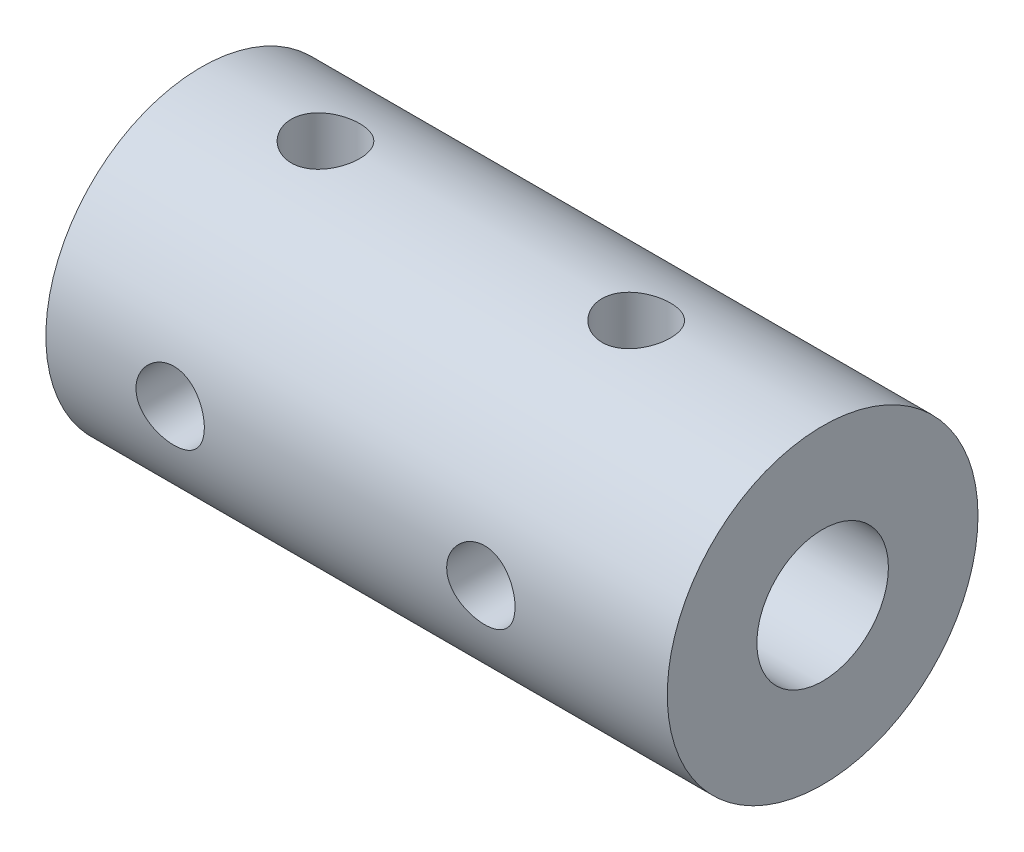
from build123d import *

# Parameters (mm, degrees)
CROQUIS1_R              = 7.5
CROQUIS1_R_2            = 3.877864762
SALIENTE_EXTRUIR1_DEPTH = 15
CROQUIS3_R              = 7.5
CROQUIS3_R_2            = 3.175
SALIENTE_EXTRUIR2_DEPTH = 15


with BuildPart() as part:
    # Croquis1 → Saliente-Extruir1 (new body)
    with BuildSketch(Plane(origin=(0, 0, 0), x_dir=(0, 0, -1), z_dir=(1, 0, 0))):
        Circle(CROQUIS1_R)
        Circle(CROQUIS1_R_2, mode=Mode.SUBTRACT)
    extrude(amount=SALIENTE_EXTRUIR1_DEPTH)

    # Croquis3 → Saliente-Extruir2 (add)
    with BuildSketch(Plane(origin=(15, 0, 0), x_dir=(0, 0, -1), z_dir=(1, 0, 0))):
        Circle(CROQUIS3_R)
        Circle(CROQUIS3_R_2, mode=Mode.SUBTRACT)
    extrude(amount=SALIENTE_EXTRUIR2_DEPTH)

    # Croquis5 → Perforador para roscar para macho de roscar para M4x0.72 (revolve, cut)
    with BuildSketch(Plane(origin=(6, 7.5, 0), x_dir=(0, 0, 1), z_dir=(1, 0, 0))):
        Polygon((0, 0), (0, 8.491420021), (1.65, 7.5), (1.65, 0), align=None)
    revolve(axis=Axis((6, 13.85, 0), (0, -1, 0)), mode=Mode.SUBTRACT)

    # Croquis5 at point 2 (carried to point 2, square into its face) → Perforador para roscar para macho de 2 (revolve, cut)
    with BuildSketch(Plane(origin=(6, 0, 7.5), x_dir=(0, -1, 0), z_dir=(1, 0, 0))):
        Polygon((0, 0), (0, 8.491420021), (1.65, 7.5), (1.65, 0), align=None)
    revolve(axis=Axis((6, 0, 13.85), (0, 0, -1)), mode=Mode.SUBTRACT)

    # Croquis5 at point 3 (carried to point 3, square into its face) → Perforador para roscar para macho de 3 (revolve, cut)
    with BuildSketch(Plane(origin=(-116.474048572, 0, -29.182020138), x_dir=(0, 0, 1), z_dir=(1, 0, 0))):
        Polygon((0, 0), (0, 8.491420021), (1.65, 7.5), (1.65, 0), align=None)
    revolve(axis=Axis((-116.474048572, 6.35, -29.182020138), (0, -1, 0)), mode=Mode.SUBTRACT)

    # MatrizL1: read off the stored shape, not the designer's step
    # MatrizL1: loft between two sections, ruled curve by curve
    matrizl1_from = [
        Edge.make_three_point_arc((22.65, 0, 2.712370176), (21, 1.65, 2.712370176), (19.35, 0, 2.712370176)),
        Edge.make_three_point_arc((19.35, 0, 2.712370176), (21, -1.65, 2.712370176), (22.65, 0, 2.712370176)),
    ]
    matrizl1_to = [
        Edge.make_three_point_arc((22.65, 0, 7.500099893), (21, 1.65, 7.500099893), (19.35, 0, 7.500099893)),
        Edge.make_three_point_arc((19.35, 0, 7.500099893), (21, -1.65, 7.500099893), (22.65, 0, 7.500099893)),
    ]
    matrizl1 = Solid(Shell([*[Face.make_surface_from_curves(matrizl1_from[k], matrizl1_to[k]) for k in range(2)], Face(Wire(matrizl1_from)), Face(Wire(matrizl1_to))]))
    add(matrizl1, mode=Mode.SUBTRACT)

    # MatrizL1 2: loft between two sections, ruled curve by curve
    matrizl1_2_from = [
        Edge.make_three_point_arc((21, 2.712383518, 1.65), (22.65, 2.712383518, 0), (21, 2.712383518, -1.65)),
        Edge.make_three_point_arc((21, 2.712383518, -1.65), (19.35, 2.712383518, 0), (21, 2.712383518, 1.65)),
    ]
    matrizl1_2_to = [
        Edge.make_three_point_arc((21, 7.50002686, 1.65), (22.65, 7.50002686, 0), (21, 7.50002686, -1.65)),
        Edge.make_three_point_arc((21, 7.50002686, -1.65), (19.35, 7.50002686, 0), (21, 7.50002686, 1.65)),
    ]
    matrizl1_2 = Solid(Shell([*[Face.make_surface_from_curves(matrizl1_2_from[k], matrizl1_2_to[k]) for k in range(2)], Face(Wire(matrizl1_2_from)), Face(Wire(matrizl1_2_to))]))
    add(matrizl1_2, mode=Mode.SUBTRACT)


solid = part.part
